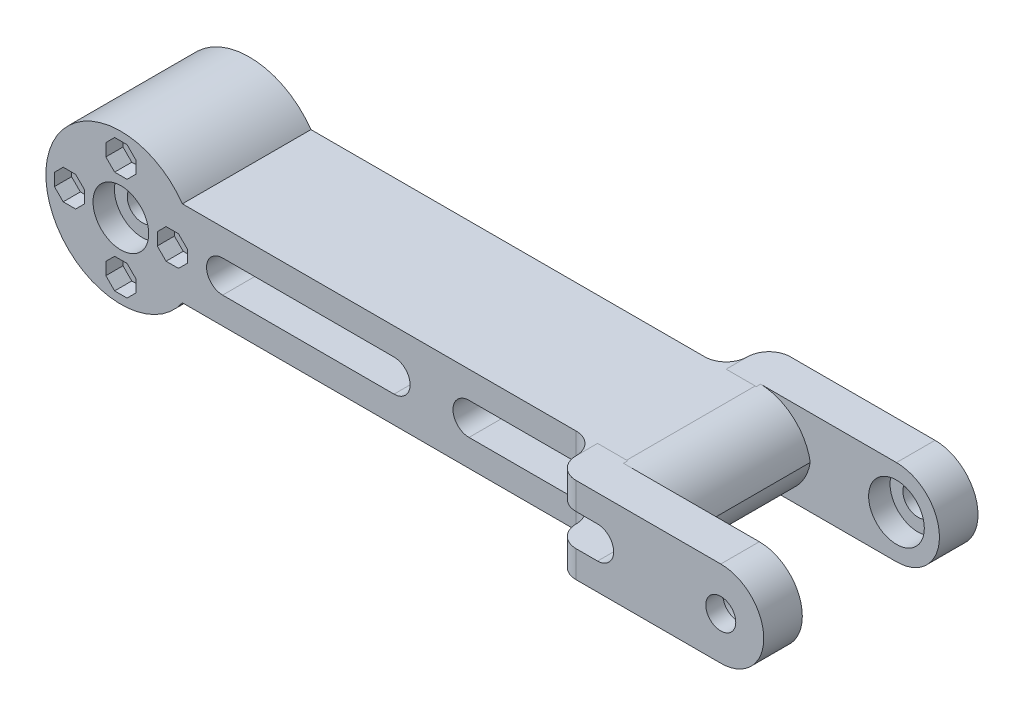
from build123d import *

# Parameters (mm, degrees)
BOSS_EXTRUDE1_OUTLINE_R  = 3.5
BOSS_EXTRUDE1_DEPTH      = 30
CUT_EXTRUDE6_DEPTH       = 164.769781491
BOSS_EXTRUDE3_START      = -40
BOSS_EXTRUDE3_OUTLINE_R  = 3.5
BOSS_EXTRUDE3_DEPTH      = 50
SKETCH18_W               = 30
SKETCH18_H               = 32
CUT_EXTRUDE7_DEPTH       = 168.246328946
FILLET1_R                = 5
SKETCH19_R               = 6.5
CUT_EXTRUDE8_DEPTH       = 5
CUT_EXTRUDE9_START       = -5
SKETCH20_R               = 6.5
CUT_EXTRUDE9_DEPTH       = 5
SKETCH22_R               = 2
CUT_EXTRUDE10_DEPTH      = 166.878034319
CUT_EXTRUDE11_DEPTH      = 4
CUT_EXTRUDE12_DEPTH      = 37
CUT_EXTRUDE12_DEPTH_BACK = 5
SKETCH24_R               = 6.5
FILLET2_R                = 12


# Read off the part's stored shape, not the designer's step: Boss-Extrude1, Boss-Extrude3
with BuildPart() as part:
    # Boss-Extrude1 outline → Boss-Extrude1 (new body)
    with BuildSketch(Plane.XY):
        with BuildLine():
            ThreePointArc((150, -10.044654174), (160.044654174, 0), (150, 10.044654174))
            Line((150, 10.044654174), (14.361406616, 10))
            ThreePointArc((14.361406616, 10), (-17.5, 0), (14.361406616, -10))
            Line((14.361406616, -10), (150, -10.044654174))
        make_face()
        Circle(BOSS_EXTRUDE1_OUTLINE_R, mode=Mode.SUBTRACT)
        with Locations((150, 0)):
            Circle(BOSS_EXTRUDE1_OUTLINE_R, mode=Mode.SUBTRACT)
    extrude(amount=BOSS_EXTRUDE1_DEPTH)

    # Sketch16 → Cut-Extrude6 (cut, through all)
    with BuildSketch(Plane.XY.offset(30)):
        with BuildLine():
            Line((23.751036832, 3.747580757), (63.751036832, 3.736519684))
            ThreePointArc((63.751036832, 3.736519684), (67.499999713, -0.014517148), (63.748962881, -3.763480029))
            Line((63.748962881, -3.763480029), (23.748962881, -3.752418957))
            ThreePointArc((23.748962881, -3.752418957), (20, -0.001382124), (23.751036832, 3.747580757))
        make_face()
        with BuildLine():
            Line((121.248962594, 3.747580757), (81.248962594, 3.736519684))
            ThreePointArc((81.248962594, 3.736519684), (77.499999713, -0.014517148), (81.251036545, -3.763480029))
            Line((81.251036545, -3.763480029), (121.251036545, -3.752418957))
            ThreePointArc((121.251036545, -3.752418957), (124.999999426, -0.001382124), (121.248962594, 3.747580757))
        make_face()
    extrude(amount=-CUT_EXTRUDE6_DEPTH, mode=Mode.SUBTRACT)

    # Boss-Extrude3 outline → Boss-Extrude3 (add)
    with BuildSketch(Plane.XY.offset(30).offset(BOSS_EXTRUDE3_START)):
        with BuildLine():
            ThreePointArc((121.248962594, 3.747580757), (124.999999426, -0.001382125), (121.251036545, -3.752418957))
            Line((121.251036545, -3.752418957), (111.251036642, -3.755184225))
            Line((111.251036642, -3.755184225), (111.251036642, -10.031897459))
            Line((111.251036642, -10.031897459), (150, -10.028973219))
            ThreePointArc((150, -10.028973219), (160.028973219, 0), (150, 10.028973219))
            Line((150, 10.028973219), (111.251036642, 10.031897459))
            Line((111.251036642, 10.031897459), (111.251036642, 3.744816062))
            Line((111.251036642, 3.744816062), (121.248962594, 3.747580757))
        make_face()
        with Locations((150, 0)):
            Circle(BOSS_EXTRUDE3_OUTLINE_R, mode=Mode.SUBTRACT)
    extrude(amount=BOSS_EXTRUDE3_DEPTH)

    # Sketch18 → Cut-Extrude7 (cut, through all)
    with BuildSketch(Plane(origin=(-0.003290587, 9.995270935, 0), x_dir=(0.9999999458089536, 0.00032921435296474953, 0), z_dir=(-0.00032921435296474953, 0.9999999458089536, 0))):
        with Locations((145.044646414, -15)):
            Rectangle(SKETCH18_W, SKETCH18_H)
    extrude(amount=-CUT_EXTRUDE7_DEPTH, mode=Mode.SUBTRACT)

    # Fillet1
    # the kernel refuses this fillet: 5 mm, written as the material it adds along each edge
    with BuildSketch(Plane(origin=(111.251036642, -22.531897459, 30), x_dir=(-1, 0, 0), z_dir=(0, 1, 0))) as fillet1_piece_1_section:
        with BuildLine():
            CenterArc((FILLET1_R, FILLET1_R), FILLET1_R, 180, 90)
            Line((0, FILLET1_R), (0, 0))
            Line((0, 0), (FILLET1_R, 0))
        make_face()
    fillet1_piece_1 = extrude(amount=31.276713234, mode=Mode.PRIVATE)
    fillet1_piece_1 = split(fillet1_piece_1, bisect_by=Plane(origin=(110.118139828, -10.031524493, 31.132041481), z_dir=(0.0003292143516537731, 0.9999999458089539, 0)), keep=Keep.TOP, mode=Mode.PRIVATE)
    fillet1_piece_1 = split(fillet1_piece_1, bisect_by=Plane(origin=(110.118305162, -3.755497455, 31.132041481), z_dir=(0.00027652679874676846, -0.9999999617664641, 0)), keep=Keep.TOP, mode=Mode.PRIVATE)
    add(fillet1_piece_1)
    with BuildSketch(Plane(origin=(111.251036642, -22.531897459, 30), x_dir=(-1, 0, 0), z_dir=(0, 1, 0))) as fillet1_piece_2_section:
        with BuildLine():
            CenterArc((FILLET1_R, FILLET1_R), FILLET1_R, 180, 90)
            Line((0, FILLET1_R), (0, 0))
            Line((0, 0), (FILLET1_R, 0))
        make_face()
    fillet1_piece_2 = extrude(amount=31.276713234, mode=Mode.PRIVATE)
    fillet1_piece_2 = split(fillet1_piece_2, bisect_by=Plane(origin=(110.119688174, 3.744503214, 31.131937612), z_dir=(-0.00027652679874677963, 0.9999999617664641, 0)), keep=Keep.TOP, mode=Mode.PRIVATE)
    add(fillet1_piece_2)
    with BuildSketch(Plane(origin=(111.251036642, -22.531897459, 0), x_dir=(-1, 0, 0), z_dir=(0, 1, 0))) as fillet1_piece_3_section:
        with BuildLine():
            CenterArc((FILLET1_R, -FILLET1_R), FILLET1_R, 90, 90)
            Line((0, -FILLET1_R), (0, 0))
            Line((0, 0), (FILLET1_R, 0))
        make_face()
    fillet1_piece_3 = extrude(amount=31.276713234, mode=Mode.PRIVATE)
    fillet1_piece_3 = split(fillet1_piece_3, bisect_by=Plane(origin=(110.118139828, -10.031524493, -1.132041481), z_dir=(0.0003292143516537731, 0.9999999458089539, 0)), keep=Keep.TOP, mode=Mode.PRIVATE)
    fillet1_piece_3 = split(fillet1_piece_3, bisect_by=Plane(origin=(110.118305162, -3.755497455, -1.132041481), z_dir=(0.00027652679874676846, -0.9999999617664641, 0)), keep=Keep.TOP, mode=Mode.PRIVATE)
    add(fillet1_piece_3)
    with BuildSketch(Plane(origin=(111.251036642, -22.531897459, 0), x_dir=(-1, 0, 0), z_dir=(0, 1, 0))) as fillet1_piece_4_section:
        with BuildLine():
            CenterArc((FILLET1_R, -FILLET1_R), FILLET1_R, 90, 90)
            Line((0, -FILLET1_R), (0, 0))
            Line((0, 0), (FILLET1_R, 0))
        make_face()
    fillet1_piece_4 = extrude(amount=31.276713234, mode=Mode.PRIVATE)
    fillet1_piece_4 = split(fillet1_piece_4, bisect_by=Plane(origin=(110.119688174, 3.744503214, -1.131937612), z_dir=(-0.00027652679874677963, 0.9999999617664641, 0)), keep=Keep.TOP, mode=Mode.PRIVATE)
    add(fillet1_piece_4)
    with BuildSketch(Plane(origin=(111.251036642, -8.755183938, 30), x_dir=(-1, 0, 0), z_dir=(0, 1, 0))) as fillet1_piece_5_section:
        with BuildLine():
            CenterArc((FILLET1_R, FILLET1_R), FILLET1_R, 180, 90)
            Line((0, FILLET1_R), (0, 0))
            Line((0, 0), (FILLET1_R, 0))
        make_face()
    fillet1_piece_5 = extrude(amount=31.287081397, mode=Mode.PRIVATE)
    fillet1_piece_5 = split(fillet1_piece_5, bisect_by=Plane(origin=(110.118434062, -3.75549742, 31.132013536), z_dir=(0.00027652679874676846, -0.9999999617664641, 0)), keep=Keep.TOP, mode=Mode.PRIVATE)
    add(fillet1_piece_5)
    with BuildSketch(Plane(origin=(111.251036642, -8.755183938, 30), x_dir=(-1, 0, 0), z_dir=(0, 1, 0))) as fillet1_piece_6_section:
        with BuildLine():
            CenterArc((FILLET1_R, FILLET1_R), FILLET1_R, 180, 90)
            Line((0, FILLET1_R), (0, 0))
            Line((0, 0), (FILLET1_R, 0))
        make_face()
    fillet1_piece_6 = extrude(amount=31.287081397, mode=Mode.PRIVATE)
    fillet1_piece_6 = split(fillet1_piece_6, bisect_by=Plane(origin=(110.11803561, 10.031524458, 31.131980984), z_dir=(0.0003292143516537731, -0.9999999458089539, 0)), keep=Keep.TOP, mode=Mode.PRIVATE)
    fillet1_piece_6 = split(fillet1_piece_6, bisect_by=Plane(origin=(110.119939764, 3.744503284, 31.131980984), z_dir=(-0.00027652679874677963, 0.9999999617664641, 0)), keep=Keep.TOP, mode=Mode.PRIVATE)
    add(fillet1_piece_6)
    with BuildSketch(Plane(origin=(111.251036642, -8.755183938, 0), x_dir=(-1, 0, 0), z_dir=(0, 1, 0))) as fillet1_piece_7_section:
        with BuildLine():
            CenterArc((FILLET1_R, -FILLET1_R), FILLET1_R, 90, 90)
            Line((0, -FILLET1_R), (0, 0))
            Line((0, 0), (FILLET1_R, 0))
        make_face()
    fillet1_piece_7 = extrude(amount=31.287081397, mode=Mode.PRIVATE)
    fillet1_piece_7 = split(fillet1_piece_7, bisect_by=Plane(origin=(110.118434062, -3.75549742, -1.132013536), z_dir=(0.00027652679874676846, -0.9999999617664641, 0)), keep=Keep.TOP, mode=Mode.PRIVATE)
    add(fillet1_piece_7)
    with BuildSketch(Plane(origin=(111.251036642, -8.755183938, 0), x_dir=(-1, 0, 0), z_dir=(0, 1, 0))) as fillet1_piece_8_section:
        with BuildLine():
            CenterArc((FILLET1_R, -FILLET1_R), FILLET1_R, 90, 90)
            Line((0, -FILLET1_R), (0, 0))
            Line((0, 0), (FILLET1_R, 0))
        make_face()
    fillet1_piece_8 = extrude(amount=31.287081397, mode=Mode.PRIVATE)
    fillet1_piece_8 = split(fillet1_piece_8, bisect_by=Plane(origin=(110.11803561, 10.031524458, -1.131980984), z_dir=(0.0003292143516537731, -0.9999999458089539, 0)), keep=Keep.TOP, mode=Mode.PRIVATE)
    fillet1_piece_8 = split(fillet1_piece_8, bisect_by=Plane(origin=(110.119939764, 3.744503284, -1.131980984), z_dir=(-0.00027652679874677963, 0.9999999617664641, 0)), keep=Keep.TOP, mode=Mode.PRIVATE)
    add(fillet1_piece_8)
    # the kernel refuses this fillet: 5 mm, written as the material it takes off along each edge
    with BuildSketch(Plane(origin=(111.251036642, 8.744815775, 40), x_dir=(0, 0, -1), z_dir=(0, -1, 0)), Plane(origin=(111.251036642, 8.744815775, -10), x_dir=(1, 0, 0), z_dir=(0, -1, 0))) as fillet1_2_piece_1:
        with BuildLine():
            CenterArc((FILLET1_R, FILLET1_R), FILLET1_R, 180, 90)
            Line((0, FILLET1_R), (0, 0))
            Line((0, 0), (FILLET1_R, 0))
        make_face()
    extrude(amount=31.276713234, mode=Mode.SUBTRACT)
    with BuildSketch(Plane(origin=(111.251036642, 22.531897459, 40), x_dir=(1, 0, 0), z_dir=(0, -1, 0)), Plane(origin=(111.251036642, 22.531897459, -10), x_dir=(0, 0, 1), z_dir=(0, -1, 0))) as fillet1_2_piece_2:
        with BuildLine():
            CenterArc((FILLET1_R, -FILLET1_R), FILLET1_R, 90, 90)
            Line((0, -FILLET1_R), (0, 0))
            Line((0, 0), (FILLET1_R, 0))
        make_face()
    extrude(amount=31.287081397, mode=Mode.SUBTRACT)

    # Sketch19 → Cut-Extrude8 (cut)
    with BuildSketch(Plane.XY.offset(30)):
        Circle(SKETCH19_R)
    extrude(amount=-CUT_EXTRUDE8_DEPTH, mode=Mode.SUBTRACT)

    # Sketch20 → Cut-Extrude9 (cut)
    with BuildSketch(Plane(origin=(0, 0, 0), x_dir=(-1, 0, 0), z_dir=(0, 0, -1)).offset(CUT_EXTRUDE9_START)):
        with Locations(Location((0, 0, 0), (0, 0, 180))):
            Circle(SKETCH20_R)
    extrude(amount=CUT_EXTRUDE9_DEPTH, mode=Mode.SUBTRACT)

    # Sketch22 → Cut-Extrude10 (cut, through all)
    with BuildSketch(Plane(origin=(0, 0, 0), x_dir=(-1, 0, 0), z_dir=(0, 0, -1))):
        with Locations((-12, 0)):
            Circle(SKETCH22_R)
        with Locations((0, 12)):
            Circle(SKETCH22_R)
        with Locations((12, 0)):
            Circle(SKETCH22_R)
        with Locations((0, -12)):
            Circle(SKETCH22_R)
    extrude(amount=-CUT_EXTRUDE10_DEPTH, mode=Mode.SUBTRACT)

    # Sketch23 → Cut-Extrude11 (cut)
    with BuildSketch(Plane.XY.offset(30)):
        Polygon((-1.449747468, 8.5), (1.449747468, 8.5), (3.5, 10.550252532), (3.5, 13.449747468), (1.449747468, 15.5), (-1.449747468, 15.5), (-3.5, 13.449747468), (-3.5, 10.550252532), align=None)
        Polygon((10.550252532, 3.5), (8.5, 1.449747468), (8.5, -1.449747468), (10.550252532, -3.5), (13.449747468, -3.5), (15.5, -1.449747468), (15.5, 1.449747468), (13.449747468, 3.5), align=None)
        Polygon((3.5, -10.550252532), (1.449747468, -8.5), (-1.449747468, -8.5), (-3.5, -10.550252532), (-3.5, -13.449747468), (-1.449747468, -15.5), (1.449747468, -15.5), (3.5, -13.449747468), align=None)
        Polygon((-10.550252532, -3.5), (-8.5, -1.449747468), (-8.5, 1.449747468), (-10.550252532, 3.5), (-13.449747468, 3.5), (-15.5, 1.449747468), (-15.5, -1.449747468), (-13.449747468, -3.5), align=None)
    extrude(amount=-CUT_EXTRUDE11_DEPTH, mode=Mode.SUBTRACT)

    # Sketch24 → Cut-Extrude12 (cut, two sides: drawn at the far end of the back side and taken through both)
    with BuildSketch(Plane.XY.offset(-1).offset(-CUT_EXTRUDE12_DEPTH_BACK)):
        with Locations((150, 0)):
            Circle(SKETCH24_R)
    extrude(amount=CUT_EXTRUDE12_DEPTH + CUT_EXTRUDE12_DEPTH_BACK, mode=Mode.SUBTRACT)

    # Fillet2
    # the kernel refuses this fillet: 12 mm, written as the material it takes off along each edge
    with BuildSketch(Plane(origin=(130.047958143, -10.038085675, 60.019759367), x_dir=(-0.9999999458089538, 0.00032921435200012727, 0), z_dir=(0, 0, -1))) as fillet2_piece_1_section:
        with BuildLine():
            CenterArc((FILLET2_R * 1.00065864558, FILLET2_R), FILLET2_R, 179.962274813, 90.037725187)
            Line((FILLET2_R * 0.000658862340412, FILLET2_R * 1.00065842867), (0, 0))
            Line((0, 0), (FILLET2_R * 1.00065864558, 0))
        make_face()
    fillet2_piece_1 = extrude(amount=90.039518735, mode=Mode.PRIVATE)
    fillet2_piece_1 = split(fillet2_piece_1, bisect_by=Plane(origin=(127.369282956, -7.349412759, -1), z_dir=(0, 0, 1)), keep=Keep.TOP, mode=Mode.PRIVATE)
    fillet2_piece_1 = split(fillet2_piece_1, bisect_by=Plane(origin=(127.369282956, -7.349412759, 31), z_dir=(0, 0, -1)), keep=Keep.TOP, mode=Mode.PRIVATE)
    add(fillet2_piece_1, mode=Mode.SUBTRACT)
    with BuildSketch(Plane(origin=(130.04134878, 10.038083499, 60), x_dir=(-0.9999999458089538, -0.0003292143520001209, 0), z_dir=(0, 0, -1))) as fillet2_piece_2_section:
        with BuildLine():
            CenterArc((FILLET2_R, -FILLET2_R), FILLET2_R, 90, 90)
            Line((0, -FILLET2_R), (0, 0))
            Line((0, 0), (FILLET2_R, 0))
        make_face()
    fillet2_piece_2 = extrude(amount=90.000000001, mode=Mode.PRIVATE)
    fillet2_piece_2 = split(fillet2_piece_2, bisect_by=Plane(origin=(127.366469067, 7.351436926, -1), z_dir=(0, 0, 1)), keep=Keep.TOP, mode=Mode.PRIVATE)
    fillet2_piece_2 = split(fillet2_piece_2, bisect_by=Plane(origin=(127.366469067, 7.351436926, 31), z_dir=(0, 0, -1)), keep=Keep.TOP, mode=Mode.PRIVATE)
    add(fillet2_piece_2, mode=Mode.SUBTRACT)


solid = part.part
